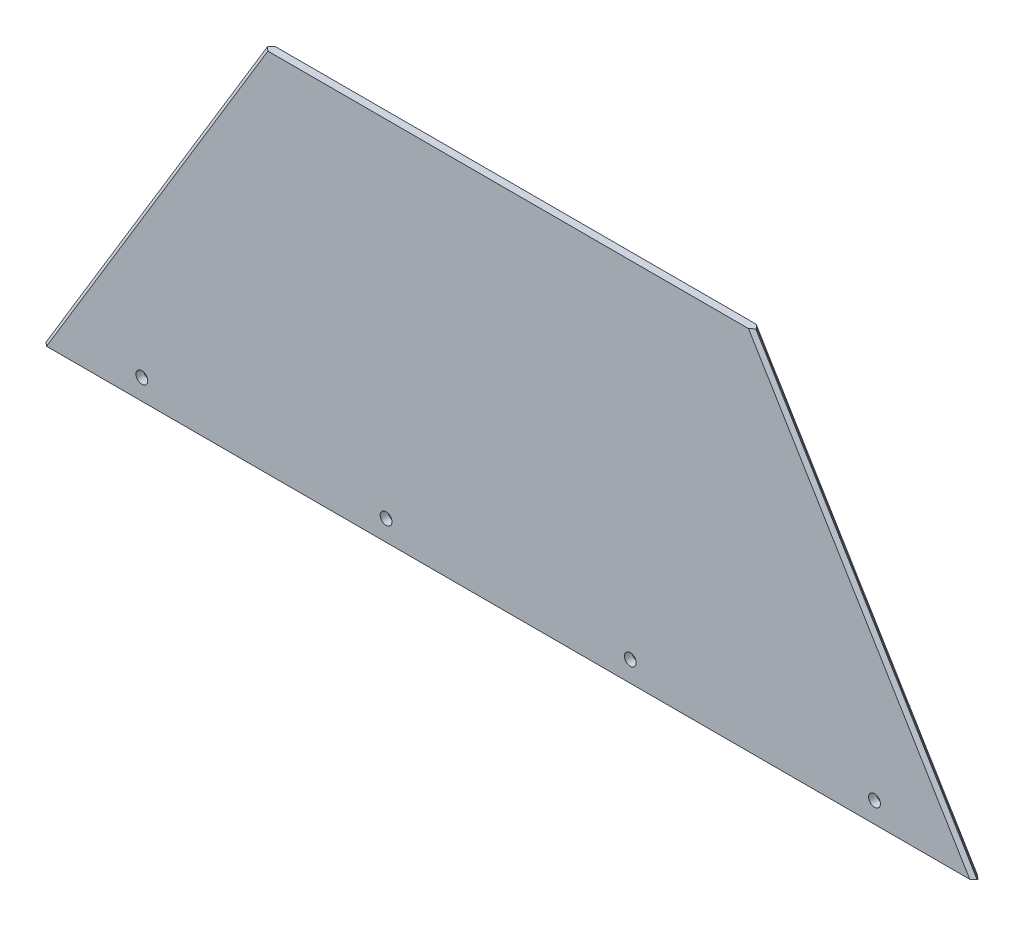
from build123d import *

# Parameters (mm, degrees)
EXTRUDE1_DEPTH               = 1.5875
CHAMFER1_SIZE                = 1.397
F_10_0_1935_DIAMETER_HOLE1_D = 4.9149
LPATTERN2_COUNT              = 3
LPATTERN2_PITCH              = 101.6
LPATTERN2_COUNT_DIR2         = 2
LPATTERN2_PITCH_DIR2         = 101.6


with BuildPart() as part:
    # Sketch1 → Extrude1 (new, symmetric)
    with BuildSketch(Plane.XY):
        Polygon((0, 0), (193.675, 0), (101.6, 152.4), (0, 152.4), (-101.6, 152.4), (-193.675, 0), align=None)
    extrude(amount=EXTRUDE1_DEPTH, both=True)

    # Chamfer1
    chamfer1_edges = [part.edges().sort_by_distance(p)[0] for p in [
        (147.6375, 76.2, -1.5875),
        (-147.6375, 76.2, -1.5875),
        (147.6375, 76.2, 1.5875),
        (-147.6375, 76.2, 1.5875),
    ]]
    chamfer(chamfer1_edges, length=CHAMFER1_SIZE)

    # #10 (0.1935) Diameter Hole1 (through all)
    with Locations(Plane(origin=(50.8, 8.5852, 1.5875), x_dir=(1, 0, 0), z_dir=(0, 0, 1))):
        with Locations((0, 0)):
            f_10_0_1935_diameter_hole1 = Hole(F_10_0_1935_DIAMETER_HOLE1_D / 2)

    # LPattern2: 10 _0.1935_ Diameter Hole1 3 × 2
    with Locations(*[Vector(-1, 0, 0) * (i * LPATTERN2_PITCH) + Vector(1, 0, 0) * (j * LPATTERN2_PITCH_DIR2) for i in range(LPATTERN2_COUNT) for j in range(LPATTERN2_COUNT_DIR2) if (i, j) != (0, 0)]):
        add(f_10_0_1935_diameter_hole1, mode=Mode.SUBTRACT)


solid = part.part
